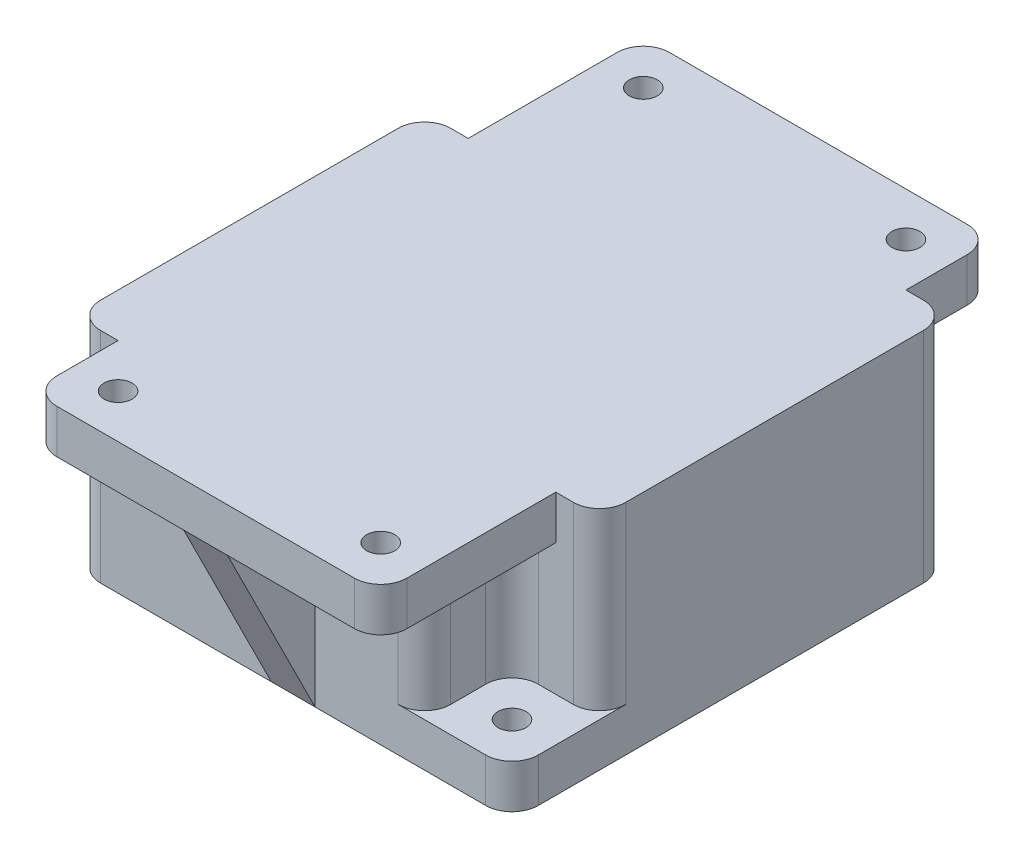
from build123d import *

# Parameters (mm, degrees)
ESQUISSE1_W             = 50
ESQUISSE1_H             = 50
ESQUISSE1_R             = 1.6
BOSS_EXTRU_1_DEPTH      = 25
CONG_1_R                = 3
ESQUISSE2_W             = 10
ESQUISSE2_H             = 10
ENL_V_MAT_EXTRU_1_DEPTH = 20
ESQUISSE4_W             = 40
ESQUISSE4_H             = 70
ESQUISSE4_R             = 1.6
BOSS_EXTRU_2_DEPTH      = 5
CONG_3_R                = 3
CONG_4_R                = 3
ENL_V_MAT_EXTRU_3_DEPTH = 2.5
BOSS_EXTRU_3_DEPTH      = 2.5
BOSS_EXTRU_3_DEPTH_BACK = 2.5


with BuildPart() as part:
    # Esquisse1 → Boss.-Extru.1 (new body)
    with BuildSketch(Plane(origin=(0, 0, 0), x_dir=(1, 0, 0), z_dir=(0, 1, 0))):
        Rectangle(ESQUISSE1_W, ESQUISSE1_H)
        with Locations((-20, 20)):
            Circle(ESQUISSE1_R, mode=Mode.SUBTRACT)
        with Locations((20, -20)):
            Circle(ESQUISSE1_R, mode=Mode.SUBTRACT)
    extrude(amount=BOSS_EXTRU_1_DEPTH)

    # Congé1
    cong_1_edges = [part.edges().sort_by_distance(p)[0] for p in [
        (-25, 12.5, -25),
        (-25, 12.5, 25),
        (25, 12.5, -25),
        (25, 12.5, 25),
    ]]
    fillet(cong_1_edges, radius=CONG_1_R)

    # Esquisse2 → Enlèv. mat.-Extru.1 (cut)
    with BuildSketch(Plane(origin=(0, 25, 0), x_dir=(1, 0, 0), z_dir=(0, 1, 0))):
        with Locations((-20, 20)):
            Rectangle(ESQUISSE2_W, ESQUISSE2_H)
        with Locations((20, -20)):
            Rectangle(ESQUISSE2_W, ESQUISSE2_H)
    extrude(amount=-ENL_V_MAT_EXTRU_1_DEPTH, mode=Mode.SUBTRACT)

    # Esquisse4 → Boss.-Extru.2 (add)
    with BuildSketch(Plane(origin=(0, 25, 0), x_dir=(1, 0, 0), z_dir=(0, 1, 0))):
        Rectangle(ESQUISSE4_W, ESQUISSE4_H)
        with Locations((-15, 30)):
            Circle(ESQUISSE4_R, mode=Mode.SUBTRACT)
        with Locations((15, 30)):
            Circle(ESQUISSE4_R, mode=Mode.SUBTRACT)
        with Locations((15, -30)):
            Circle(ESQUISSE4_R, mode=Mode.SUBTRACT)
        with Locations((-15, -30)):
            Circle(ESQUISSE4_R, mode=Mode.SUBTRACT)
    extrude(amount=-BOSS_EXTRU_2_DEPTH)

    # Congé3
    cong_3_edges = [part.edges().sort_by_distance(p)[0] for p in [
        (20, 22.5, 35),
        (-20, 22.5, 35),
        (20, 22.5, -35),
        (-20, 22.5, -35),
    ]]
    fillet(cong_3_edges, radius=CONG_3_R)

    # Congé4
    cong_4_edges = [part.edges().sort_by_distance(p)[0] for p in [
        (-25, 15, -15),
        (-15, 12.5, -25),
        (-15, 12.5, -15),
        (15, 12.5, 25),
        (15, 12.5, 15),
        (25, 15, 15),
    ]]
    fillet(cong_4_edges, radius=CONG_4_R)

    # Esquisse5 → Enlèv. mat.-Extru.3 (cut)
    with BuildSketch(Plane.XZ.offset(-20)):
        Polygon((-13.321707217, 26.643414433), (-11.253965238, 29.775151402), (-12.932258021, 33.131736969), (-16.678292783, 33.356585567), (-18.746034762, 30.224848598), (-17.067741979, 26.868263031), align=None)
        Polygon((13.296009851, 26.592019703), (17.099402439, 26.820311095), (18.803392587, 30.228291392), (16.703990149, 33.407980297), (12.900597561, 33.179688905), (11.196607413, 29.771708608), align=None)
        Polygon((13.296009851, -26.592019703), (11.196607413, -29.771708608), (12.900597561, -33.179688905), (16.703990149, -33.407980297), (18.803392587, -30.228291392), (17.099402439, -26.820311095), align=None)
        Polygon((-13.296009851, -26.592019703), (-17.099402439, -26.820311095), (-18.803392587, -30.228291392), (-16.703990149, -33.407980297), (-12.900597561, -33.179688905), (-11.196607413, -29.771708608), align=None)
    extrude(amount=-ENL_V_MAT_EXTRU_3_DEPTH, mode=Mode.SUBTRACT)

    # Esquisse6 → Boss.-Extru.3 (add, two sides: drawn at the far end of the back side and taken through both)
    with BuildSketch(Plane(origin=(0, 0, 0), x_dir=(0, 0, -1), z_dir=(1, 0, 0)).offset(-BOSS_EXTRU_3_DEPTH_BACK)):
        Polygon((-35, 20), (-25, 0), (-25, 20), align=None)
        Polygon((35, 20), (25, 0), (25, 20), align=None)
    extrude(amount=BOSS_EXTRU_3_DEPTH + BOSS_EXTRU_3_DEPTH_BACK)


solid = part.part
